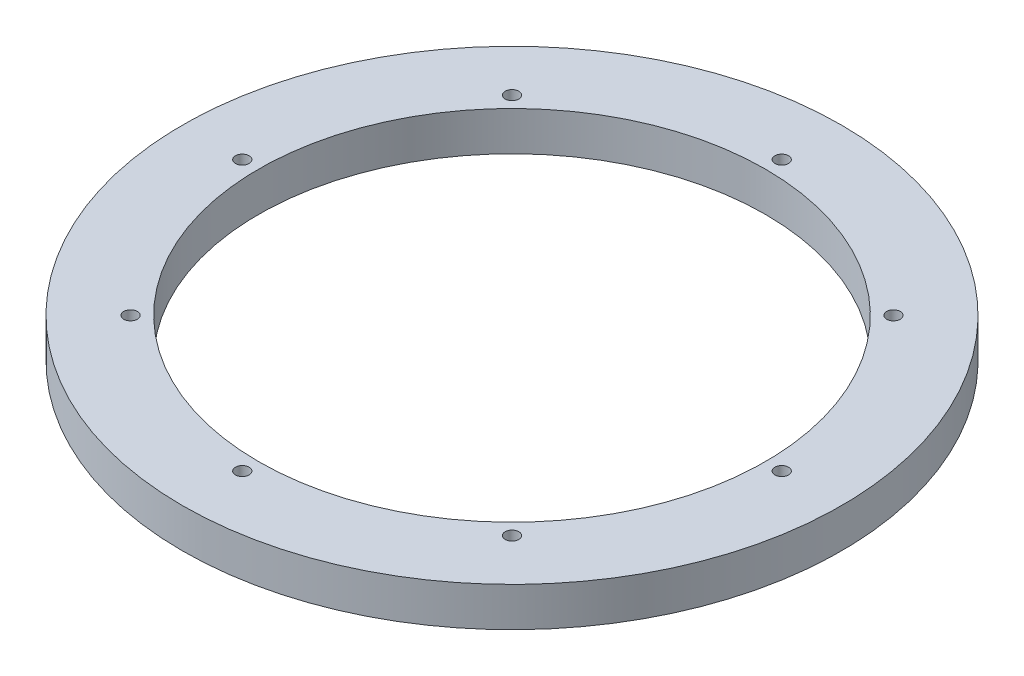
from build123d import *

# Parameters (mm, degrees)
SKETCH1_R           = 64.008
SKETCH1_R_2         = 1.3208
SKETCH1_R_3         = 49.2125
BOSS_EXTRUDE1_DEPTH = 7.62


with BuildPart() as part:
    # Sketch1 → Boss-Extrude1 (new body)
    with BuildSketch(Plane(origin=(0, 0, 0), x_dir=(1, 0, 0), z_dir=(0, 1, 0))):
        Circle(SKETCH1_R)
        with Locations((-37.043556499, -37.043556499)):
            Circle(SKETCH1_R_2, mode=Mode.SUBTRACT)
        with Locations((0, -52.3875)):
            Circle(SKETCH1_R_2, mode=Mode.SUBTRACT)
        with Locations((37.043556499, -37.043556499)):
            Circle(SKETCH1_R_2, mode=Mode.SUBTRACT)
        with Locations((-52.3875, 0)):
            Circle(SKETCH1_R_2, mode=Mode.SUBTRACT)
        with Locations((-37.043556499, 37.043556499)):
            Circle(SKETCH1_R_2, mode=Mode.SUBTRACT)
        Circle(SKETCH1_R_3, mode=Mode.SUBTRACT)
        with Locations((52.3875, 0)):
            Circle(SKETCH1_R_2, mode=Mode.SUBTRACT)
        with Locations((0, 52.3875)):
            Circle(SKETCH1_R_2, mode=Mode.SUBTRACT)
        with Locations((37.043556499, 37.043556499)):
            Circle(SKETCH1_R_2, mode=Mode.SUBTRACT)
    extrude(amount=BOSS_EXTRUDE1_DEPTH)


solid = part.part
